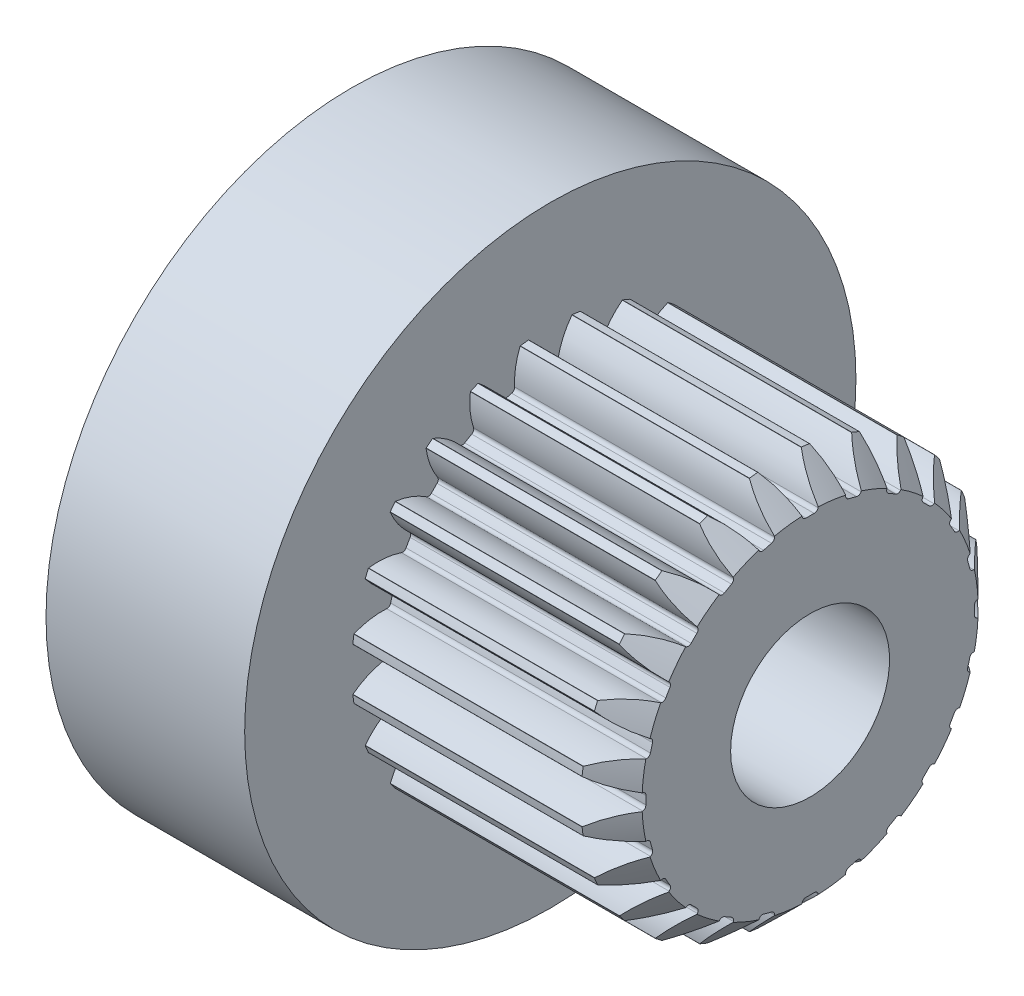
from build123d import *

# Parameters (mm, degrees)
BASPROSKE_W                = 8.5
BASPROSKE_H                = 6.500000000000001
TOOTHCUT_DEPTH             = 13.519984025548915
BREAKS_R                   = 0.01
ROOTFILLETS_R              = 0.126
TEETHCUTS_COUNT            = 24
TEETHCUTS_ANGLE            = 345.0000000000008
BREAKS_OF_TEETHCUTS_R      = 0.01
ROOTFILLETS_OF_TEETHCUTS_R = 0.126
HUBNEAONESKE_R             = 5
HUBNEARONE_DEPTH           = 6.5000508
BORSKE_R                   = 2.6000000000000005
BORE_DEPTH                 = 20.0000508
BOSS_EXTRUDE1_START        = -6.5000508
SKETCH1_R                  = 10
SKETCH1_R_2                = 2.6000000000000005
BOSS_EXTRUDE1_DEPTH        = 6.5000508
SKETCH7_R                  = 1.8
CUT_EXTRUDE7_DEPTH         = 17.50000017272729
SKETCH8_W                  = 5.5
SKETCH8_H                  = 2.1000000000000005
CUT_EXTRUDE8_DEPTH         = 2.5
SKETCH9_W                  = 5.5
SKETCH9_H                  = 2.1000000000000005
CUT_EXTRUDE9_DEPTH         = 21.076434712227034


with BuildPart() as part:
    # BasProSke → Base-Revolve (revolve)
    with BuildSketch(Plane(origin=(0, 0, 0), x_dir=(1, 0, 0), z_dir=(0, 1, 0)), mode=Mode.PRIVATE) as base_revolve_sk:
        with Locations((4.25, 3.2500000000000004)):
            Rectangle(BASPROSKE_W, BASPROSKE_H)
    revolve(base_revolve_sk.sketch.rotate(Axis((-10, 0, 0), (1, 0, 0)), 180), axis=Axis((-10, 0, 0), (1, 0, 0)))

    # TooCutSke → ToothCut (cut, through all)
    with BuildSketch(Plane(origin=(0, 0, 0), x_dir=(0, 0, -1), z_dir=(1, 0, 0))):
        with BuildLine():
            ThreePointArc((0.2416461081958957, 5.368564347979241), (3.3e-16, 5.374), (-0.2416461081958957, 5.368564347979241))
            ThreePointArc((-0.2416461081958957, 5.368564347979241), (-0.4136999570458344, 5.957993365165113), (-0.7296860368052384, 6.484474030150129))
            ThreePointArc((-0.7296860368052384, 6.484474030150129), (4e-16, 6.525399999999999), (0.7296860368052384, 6.484474030150129))
            ThreePointArc((0.7296860368052384, 6.484474030150129), (0.41369995704583573, 5.9579933651651125), (0.2416461081958957, 5.368564347979241))
        make_face()
    toothcut = extrude(amount=TOOTHCUT_DEPTH, mode=Mode.SUBTRACT)

    # Breaks
    # the kernel refuses this fillet: 0.01 mm, written as the material it takes off along each edge
    with BuildSketch(Plane(origin=(-0.0141063886709076, 6.460959589415369, -0.7113376019455104), x_dir=(0, -0.7929099100276569, 0.6093388832004184), z_dir=(1, 0, 0))) as breaks_piece_1:
        with BuildLine():
            CenterArc((0.00563080014443655, 0.00999999309061561), BREAKS_R, 211.20920670905093, 58.85814635104691)
            ThreePointArc((-0.00292200994268142, 0.00481834860129642), (-0.00146152712507896, 0.00240885764892245), (0, 0))
            ThreePointArc((0, 0), (0.00282127773416398, -1.65825225064e-06), (0.00564255546832916, 0))
        make_face()
    extrude(amount=8.528212777341647, mode=Mode.SUBTRACT)
    with BuildSketch(Plane(origin=(-0.01410638867090685, 6.460959589415369, 0.7113376019455102), x_dir=(0, -0.7929099100276678, -0.6093388832004042), z_dir=(1, 0, 0))) as breaks_piece_2:
        with BuildLine():
            CenterArc((0.00563080014443777, -0.00999999309061561), BREAKS_R, 89.93264693990317, 58.858146351028566)
            ThreePointArc((-0.00292200994267833, -0.00481834860129402), (-0.00146152712507387, -0.00240885764891446), (0, 0))
            ThreePointArc((0, 0), (0.00282127773416523, 1.65825225086e-06), (0.0056425554683302, 0))
        make_face()
    extrude(amount=8.528212777341647, mode=Mode.SUBTRACT)

    # RootFillets
    rootfillets_edges = [part.edges().sort_by_distance(p)[0] for p in [
        (4.25, 5.368564347979241, -0.24164610819589544),
        (4.25, 5.368564347979241, 0.24164610819589563),
    ]]
    fillet(rootfillets_edges, radius=ROOTFILLETS_R)

    # TeethCuts: ToothCut ×24 about axis
    teethcuts_axis = Axis((-10, 0, 0), (1, 0, 0))
    for i in range(1, TEETHCUTS_COUNT):
        add(toothcut.rotate(teethcuts_axis, i * TEETHCUTS_ANGLE / (TEETHCUTS_COUNT - 1)), mode=Mode.SUBTRACT)

    # Breaks of TeethCuts
    # the kernel refuses this fillet: 0.01 mm, written as the material it takes off along each edge
    with BuildSketch(Plane(origin=(-0.01410638867090785, 6.424915448907373, 0.985120030448763), x_dir=(0, 0.15112844965438915, -0.988514133285438), z_dir=(1, 0, 0))) as breaks_of_teethcuts_piece_1:
        with BuildLine():
            CenterArc((0.00563078954221437, -0.00999999906051367), BREAKS_OF_TEETHCUTS_R, 89.97516393486379, 58.85814635104916)
            ThreePointArc((-0.0029258632888678, -0.0048247027087736), (-0.00146434954350002, -0.00241149149232399), (0, 0))
            ThreePointArc((0, 0), (0.00281756212659148, 6.1066590053e-07), (0.00563512425317729, 0))
        make_face()
    extrude(amount=8.528212777341647, mode=Mode.SUBTRACT)
    with BuildSketch(Plane(origin=(-0.01410638867091247, 6.056700011145264, 2.359318752308165), x_dir=(0, -0.6081836521223912, -0.7937963500111791), z_dir=(1, 0, 0))) as breaks_of_teethcuts_piece_2:
        with BuildLine():
            CenterArc((0.00563080014443676, -0.00999999309061569), BREAKS_OF_TEETHCUTS_R, 89.9326469398973, 58.858146351029404)
            ThreePointArc((-0.002922009942679, -0.00481834860129328), (-0.00146152712507712, -0.00240885764891895), (0, 0))
            ThreePointArc((0, 0), (0.00282127773416467, 1.65825225092e-06), (0.00564255546833021, 0))
        make_face()
    extrude(amount=8.528212777341658, mode=Mode.SUBTRACT)
    with BuildSketch(Plane(origin=(-0.01410638867090776, 5.951023938231137, 2.614443360755777), x_dir=(0, 0.4018251566555056, -0.9157164099647763), z_dir=(1, 0, 0))) as breaks_of_teethcuts_piece_3:
        with BuildLine():
            CenterArc((0.00563078954221485, -0.00999999906051393), BREAKS_OF_TEETHCUTS_R, 89.97516393486309, 58.85814635104218)
            ThreePointArc((-0.00292586328886661, -0.00482470270877273), (-0.00146434954349871, -0.00241149149232289), (0, 0))
            ThreePointArc((0, 0), (0.00281756212659176, 6.1066590085e-07), (0.00563512425317789, 0))
        make_face()
    extrude(amount=8.528212777341647, mode=Mode.SUBTRACT)
    with BuildSketch(Plane(origin=(-0.01410638867090984, 5.239686336285626, 3.846516228659606), x_dir=(0, -0.38201068339611227, -0.9241579073790557), z_dir=(1, 0, 0))) as breaks_of_teethcuts_piece_4:
        with BuildLine():
            CenterArc((0.00563080014443654, -0.00999999309061607), BREAKS_OF_TEETHCUTS_R, 89.93264693989873, 58.858146351022455)
            ThreePointArc((-0.00292200994267875, -0.00481834860129282), (-0.00146152712507713, -0.00240885764891821), (0, 0))
            ThreePointArc((0, 0), (0.00282127773416588, 1.65825225051e-06), (0.00564255546832975, 0))
        make_face()
    extrude(amount=8.52821277734165, mode=Mode.SUBTRACT)
    with BuildSketch(Plane(origin=(-0.01410638867091184, 5.0715799806965, 4.06559669659922), x_dir=(0, 0.6251381432780814, -0.7805141265978681), z_dir=(1, 0, 0))) as breaks_of_teethcuts_piece_5:
        with BuildLine():
            CenterArc((0.00563078954220711, -0.00999999906051358), BREAKS_OF_TEETHCUTS_R, 89.97516393485647, 58.8581463510305)
            ThreePointArc((-0.00292586328887291, -0.00482470270876951), (-0.0014643495435013, -0.00241149149232257), (0, 0))
            ThreePointArc((0, 0), (0.00281756212658576, 6.1066590059e-07), (0.00563512425317131, 0))
        make_face()
    extrude(amount=8.528212777341656, mode=Mode.SUBTRACT)
    with BuildSketch(Plane(origin=(-0.01410638867090418, 4.0655966965992025, 5.071579980696514), x_dir=(0, -0.1298043178990405, -0.9915396306022088), z_dir=(1, 0, 0))) as breaks_of_teethcuts_piece_6:
        with BuildLine():
            CenterArc((0.00563080014443722, -0.00999999309061523), BREAKS_OF_TEETHCUTS_R, 89.93264693990731, 58.85814635105554)
            ThreePointArc((-0.00292200994268193, -0.00481834860129815), (-0.00146152712507574, -0.0024088576489189), (0, 0))
            ThreePointArc((0, 0), (0.00282127773416439, 1.65825225115e-06), (0.00564255546832893, 0))
        make_face()
    extrude(amount=8.52821277734164, mode=Mode.SUBTRACT)
    with BuildSketch(Plane(origin=(-0.01410638867090556, 3.8465162286595866, 5.239686336285639), x_dir=(0, 0.8058489985258117, -0.5921210953639013), z_dir=(1, 0, 0))) as breaks_of_teethcuts_piece_7:
        with BuildLine():
            CenterArc((0.00563078954221272, -0.0099999990605139), BREAKS_OF_TEETHCUTS_R, 89.97516393485175, 58.85814635104741)
            ThreePointArc((-0.00292586328886815, -0.0048247027087718), (-0.00146434954350067, -0.00241149149232245), (0, 0))
            ThreePointArc((0, 0), (0.00281756212659191, 6.1066590041e-07), (0.00563512425317774, 0))
        make_face()
    extrude(amount=8.528212777341643, mode=Mode.SUBTRACT)
    with BuildSketch(Plane(origin=(-0.01410638867090834, 2.6144433607557565, 5.951023938231146), x_dir=(0, 0.13124799735132045, -0.9913495665966007), z_dir=(1, 0, 0))) as breaks_of_teethcuts_piece_8:
        with BuildLine():
            CenterArc((0.00563080014443814, -0.00999999309061575), BREAKS_OF_TEETHCUTS_R, 89.93264693990707, 58.85814635102807)
            ThreePointArc((-0.00292200994267834, -0.00481834860129463), (-0.00146152712507528, -0.00240885764891462), (0, 0))
            ThreePointArc((0, 0), (0.00282127773416509, 1.65825225065e-06), (0.00564255546832989, 0))
        make_face()
    extrude(amount=8.52821277734165, mode=Mode.SUBTRACT)
    with BuildSketch(Plane(origin=(-0.01410638867090896, 2.359318752308144, 6.056700011145273), x_dir=(0, 0.9316425762523523, -0.3633759900074302), z_dir=(1, 0, 0))) as breaks_of_teethcuts_piece_9:
        with BuildLine():
            CenterArc((0.00563078954221484, -0.0099999990605142), BREAKS_OF_TEETHCUTS_R, 89.97516393486302, 58.8581463510416)
            ThreePointArc((-0.00292586328886624, -0.0048247027087731), (-0.00146434954349887, -0.00241149149232392), (0, 0))
            ThreePointArc((0, 0), (0.002817562126592, 6.1066590075e-07), (0.0056351242531779, 0))
        make_face()
    extrude(amount=8.52821277734165, mode=Mode.SUBTRACT)
    with BuildSketch(Plane(origin=(-0.01410638867090717, 0.98512003044874, 6.4249154489073765), x_dir=(0, 0.3833559784797053, -0.9236006679100376), z_dir=(1, 0, 0))) as breaks_of_teethcuts_piece_10:
        with BuildLine():
            CenterArc((0.00563080014443772, -0.00999999309061561), BREAKS_OF_TEETHCUTS_R, 89.93264693990577, 58.85814635102298)
            ThreePointArc((-0.00292200994267852, -0.00481834860129333), (-0.00146152712507609, -0.00240885764891914), (0, 0))
            ThreePointArc((0, 0), (0.00282127773416493, 1.65825225089e-06), (0.0056425554683297, 0))
        make_face()
    extrude(amount=8.528212777341647, mode=Mode.SUBTRACT)
    with BuildSketch(Plane(origin=(-0.01410638867091392, 0.7113376019454875, 6.4609595894153715), x_dir=(0, 0.9939462520195419, -0.10986741143899431), z_dir=(1, 0, 0))) as breaks_of_teethcuts_piece_11:
        with BuildLine():
            CenterArc((0.00563078954221374, -0.00999999906051379), BREAKS_OF_TEETHCUTS_R, 89.97516393485907, 58.85814635105166)
            ThreePointArc((-0.0029258632888681, -0.00482470270877347), (-0.00146434954349995, -0.00241149149232406), (0, 0))
            ThreePointArc((0, 0), (0.0028175621265916, 6.1066590077e-07), (0.00563512425317749, 0))
        make_face()
    extrude(amount=8.52821277734166, mode=Mode.SUBTRACT)
    with BuildSketch(Plane(origin=(-0.01410638867090963, -0.7113376019455324, 6.460959589415366), x_dir=(0, 0.6093388832004555, -0.7929099100276283), z_dir=(1, 0, 0))) as breaks_of_teethcuts_piece_12:
        with BuildLine():
            CenterArc((0.00563080014443629, -0.00999999309061561), BREAKS_OF_TEETHCUTS_R, 89.93264693989946, 58.85814635103873)
            ThreePointArc((-0.00292200994268056, -0.00481834860129488), (-0.00146152712507761, -0.00240885764891903), (0, 0))
            ThreePointArc((0, 0), (0.00282127773416398, 1.65825225051e-06), (0.00564255546832937, 0))
        make_face()
    extrude(amount=8.52821277734165, mode=Mode.SUBTRACT)
    with BuildSketch(Plane(origin=(-0.01410638867090513, -0.9851200304487869, 6.4249154489073685), x_dir=(0, 0.9885141332854086, 0.15112844965458144), z_dir=(1, 0, 0))) as breaks_of_teethcuts_piece_13:
        with BuildLine():
            CenterArc((0.00563078954221125, -0.00999999906051369), BREAKS_OF_TEETHCUTS_R, 89.97516393485327, 58.85814635103742)
            ThreePointArc((-0.00292586328886888, -0.00482470270877032), (-0.00146434954350014, -0.00241149149232286), (0, 0))
            ThreePointArc((0, 0), (0.00281756212658786, 6.1066590054e-07), (0.005635124253176, 0))
        make_face()
    extrude(amount=8.528212777341643, mode=Mode.SUBTRACT)
    with BuildSketch(Plane(origin=(-0.01410638867090801, -2.359318752308188, 6.056700011145255), x_dir=(0, 0.79379635001115, -0.6081836521224292), z_dir=(1, 0, 0))) as breaks_of_teethcuts_piece_14:
        with BuildLine():
            CenterArc((0.00563080014443688, -0.00999999309061569), BREAKS_OF_TEETHCUTS_R, 89.93264693990004, 58.85814635103888)
            ThreePointArc((-0.00292200994268053, -0.00481834860129477), (-0.00146152712507736, -0.00240885764891929), (0, 0))
            ThreePointArc((0, 0), (0.00282127773416467, 1.65825225106e-06), (0.00564255546832986, 0))
        make_face()
    extrude(amount=8.528212777341647, mode=Mode.SUBTRACT)
    with BuildSketch(Plane(origin=(-0.0141063886709082, -2.6144433607557973, 5.9510239382311285), x_dir=(0, 0.9157164099647128, 0.40182515665565066), z_dir=(1, 0, 0))) as breaks_of_teethcuts_piece_15:
        with BuildLine():
            CenterArc((0.00563078954221124, -0.00999999906051393), BREAKS_OF_TEETHCUTS_R, 89.97516393485402, 58.85814635103712)
            ThreePointArc((-0.00292586328886905, -0.00482470270877056), (-0.00146434954350027, -0.00241149149232312), (0, 0))
            ThreePointArc((0, 0), (0.00281756212658815, 6.1066590101e-07), (0.00563512425317586, 0))
        make_face()
    extrude(amount=8.528212777341649, mode=Mode.SUBTRACT)
    with BuildSketch(Plane(origin=(-0.01410638867090984, -3.846516228659624, 5.239686336285613), x_dir=(0, 0.9241579073790002, -0.3820106833962467), z_dir=(1, 0, 0))) as breaks_of_teethcuts_piece_16:
        with BuildLine():
            CenterArc((0.00563080014443875, -0.0099999930906159), BREAKS_OF_TEETHCUTS_R, 89.93264693990943, 58.85814635104043)
            ThreePointArc((-0.00292200994267949, -0.00481834860129672), (-0.00146152712507685, -0.00240885764891941), (0, 0))
            ThreePointArc((0, 0), (0.00282127773416506, 1.65825225059e-06), (0.00564255546833009, 0))
        make_face()
    extrude(amount=8.52821277734165, mode=Mode.SUBTRACT)
    with BuildSketch(Plane(origin=(-0.01410638867090801, -4.065596696599239, 5.071579980696485), x_dir=(0, 0.7805141265978223, 0.6251381432781387), z_dir=(1, 0, 0))) as breaks_of_teethcuts_piece_17:
        with BuildLine():
            CenterArc((0.00563078954221012, -0.00999999906051358), BREAKS_OF_TEETHCUTS_R, 89.97516393485225, 58.858146351041256)
            ThreePointArc((-0.00292586328886994, -0.00482470270877083), (-0.00146434954349884, -0.00241149149232344), (0, 0))
            ThreePointArc((0, 0), (0.00281756212658826, 6.1066590066e-07), (0.00563512425317505, 0))
        make_face()
    extrude(amount=8.528212777341647, mode=Mode.SUBTRACT)
    with BuildSketch(Plane(origin=(-0.01410638867090447, -5.071579980696527, 4.065596696599185), x_dir=(0, 0.9915396306022266, -0.12980431789890604), z_dir=(1, 0, 0))) as breaks_of_teethcuts_piece_18:
        with BuildLine():
            CenterArc((0.00563080014443587, -0.009999993090616), BREAKS_OF_TEETHCUTS_R, 89.93264693990525, 58.85814635103554)
            ThreePointArc((-0.00292200994268105, -0.00481834860129576), (-0.00146152712507783, -0.00240885764891893), (0, 0))
            ThreePointArc((0, 0), (0.00282127773416439, 1.65825225077e-06), (0.00564255546832793, 0))
        make_face()
    extrude(amount=8.52821277734164, mode=Mode.SUBTRACT)
    with BuildSketch(Plane(origin=(-0.01410638867090387, -5.2396863362856525, 3.846516228659568), x_dir=(0, 0.5921210953639495, 0.8058489985257764), z_dir=(1, 0, 0))) as breaks_of_teethcuts_piece_19:
        with BuildLine():
            CenterArc((0.00563078954221136, -0.0099999990605139), BREAKS_OF_TEETHCUTS_R, 89.97516393485516, 58.85814635104272)
            ThreePointArc((-0.0029258632888691, -0.00482470270877179), (-0.0014643495435, -0.00241149149232325), (0, 0))
            ThreePointArc((0, 0), (0.00281756212658783, 6.1066590088e-07), (0.00563512425317579, 0))
        make_face()
    extrude(amount=8.52821277734164, mode=Mode.SUBTRACT)
    with BuildSketch(Plane(origin=(-0.01410638867091054, -5.951023938231156, 2.614443360755735), x_dir=(0, 0.9913495665965877, 0.1312479973514183), z_dir=(1, 0, 0))) as breaks_of_teethcuts_piece_20:
        with BuildLine():
            CenterArc((0.00563080014443633, -0.00999999309061575), BREAKS_OF_TEETHCUTS_R, 89.9326469399014, 58.85814635104383)
            ThreePointArc((-0.00292200994268169, -0.00481834860129576), (-0.00146152712507809, -0.0024088576489204), (0, 0))
            ThreePointArc((0, 0), (0.00282127773416426, 1.65825225093e-06), (0.00564255546832906, 0))
        make_face()
    extrude(amount=8.528212777341654, mode=Mode.SUBTRACT)
    with BuildSketch(Plane(origin=(-0.01410638867090626, -6.0567000111452804, 2.3593187523081243), x_dir=(0, 0.3633759900073434, 0.9316425762523862), z_dir=(1, 0, 0))) as breaks_of_teethcuts_piece_21:
        with BuildLine():
            CenterArc((0.00563078954221037, -0.0099999990605142), BREAKS_OF_TEETHCUTS_R, 89.97516393485766, 58.85814635104161)
            ThreePointArc((-0.00292586328887023, -0.0048247027087723), (-0.00146434954350108, -0.0024114914923236), (0, 0))
            ThreePointArc((0, 0), (0.00281756212658689, 6.1066590136e-07), (0.00563512425317436, 0))
        make_face()
    extrude(amount=8.528212777341643, mode=Mode.SUBTRACT)
    with BuildSketch(Plane(origin=(-0.01410638867090502, -6.42491544890738, 0.9851200304487173), x_dir=(0, 0.9236006679100376, 0.3833559784797053), z_dir=(1, 0, 0))) as breaks_of_teethcuts_piece_22:
        with BuildLine():
            CenterArc((0.00563080014443772, -0.00999999309061561), BREAKS_OF_TEETHCUTS_R, 89.93264693990577, 58.858146351039295)
            ThreePointArc((-0.00292200994267963, -0.00481834860129599), (-0.00146152712507742, -0.00240885764892003), (0, 0))
            ThreePointArc((0, 0), (0.00282127773416493, 1.65825225089e-06), (0.0056425554683297, 0))
        make_face()
    extrude(amount=8.528212777341643, mode=Mode.SUBTRACT)
    with BuildSketch(Plane(origin=(-0.01410638867090844, -6.460959589415374, 0.7113376019454647), x_dir=(0, 0.10986741143902229, 0.9939462520195388), z_dir=(1, 0, 0))) as breaks_of_teethcuts_piece_23:
        with BuildLine():
            CenterArc((0.00563078954221259, -0.00999999906051379), BREAKS_OF_TEETHCUTS_R, 89.97516393486067, 58.858146351040105)
            ThreePointArc((-0.0029258632888686, -0.00482470270877184), (-0.00146434954349943, -0.00241149149232316), (0, 0))
            ThreePointArc((0, 0), (0.00281756212658885, 6.1066590055e-07), (0.00563512425317605, 0))
        make_face()
    extrude(amount=8.52821277734165, mode=Mode.SUBTRACT)
    with BuildSketch(Plane(origin=(-0.01410638867090391, -6.4609595894153635, -0.7113376019455555), x_dir=(0, 0.7929099100276094, 0.6093388832004802), z_dir=(1, 0, 0))) as breaks_of_teethcuts_piece_24:
        with BuildLine():
            CenterArc((0.00563080014443611, -0.00999999309061561), BREAKS_OF_TEETHCUTS_R, 89.93264693989767, 58.85814635104441)
            ThreePointArc((-0.00292200994268119, -0.0048183486012954), (-0.00146152712507761, -0.00240885764891889), (0, 0))
            ThreePointArc((0, 0), (0.00282127773416399, 1.65825225042e-06), (0.0056425554683295, 0))
        make_face()
    extrude(amount=8.52821277734164, mode=Mode.SUBTRACT)
    with BuildSketch(Plane(origin=(-0.01410638867091069, -6.424915448907366, -0.985120030448808), x_dir=(0, -0.15112844965442154, 0.9885141332854331), z_dir=(1, 0, 0))) as breaks_of_teethcuts_piece_25:
        with BuildLine():
            CenterArc((0.00563078954221295, -0.00999999906051369), BREAKS_OF_TEETHCUTS_R, 89.97516393486254, 58.858146351043075)
            ThreePointArc((-0.00292586328886859, -0.00482470270877251), (-0.00146434954349953, -0.00241149149232314), (0, 0))
            ThreePointArc((0, 0), (0.00281756212658873, 6.1066590086e-07), (0.00563512425317609, 0))
        make_face()
    extrude(amount=8.528212777341654, mode=Mode.SUBTRACT)
    with BuildSketch(Plane(origin=(-0.01410638867091289, -6.056700011145247, -2.359318752308206), x_dir=(0, 0.6081836521224292, 0.79379635001115), z_dir=(1, 0, 0))) as breaks_of_teethcuts_piece_26:
        with BuildLine():
            CenterArc((0.00563080014443688, -0.00999999309061569), BREAKS_OF_TEETHCUTS_R, 89.93264693990004, 58.85814635103414)
            ThreePointArc((-0.00292200994267983, -0.00481834860129423), (-0.0014615271250779, -0.00240885764891858), (0, 0))
            ThreePointArc((0, 0), (0.00282127773416521, 1.65825225035e-06), (0.00564255546832986, 0))
        make_face()
    extrude(amount=8.528212777341658, mode=Mode.SUBTRACT)
    with BuildSketch(Plane(origin=(-0.01410638867090834, -5.951023938231118, -2.614443360755821), x_dir=(0, -0.40182515665551843, 0.9157164099647708), z_dir=(1, 0, 0))) as breaks_of_teethcuts_piece_27:
        with BuildLine():
            CenterArc((0.00563078954221232, -0.00999999906051393), BREAKS_OF_TEETHCUTS_R, 89.9751639348623, 58.85814635103712)
            ThreePointArc((-0.00292586328886871, -0.00482470270877179), (-0.00146434954349992, -0.00241149149232333), (0, 0))
            ThreePointArc((0, 0), (0.00281756212658698, 6.1066590097e-07), (0.0056351242531755, 0))
        make_face()
    extrude(amount=8.52821277734165, mode=Mode.SUBTRACT)
    with BuildSketch(Plane(origin=(-0.0141063886709126, -5.239686336285597, -3.8465162286596435), x_dir=(0, 0.38201068339616784, 0.9241579073790327), z_dir=(1, 0, 0))) as breaks_of_teethcuts_piece_28:
        with BuildLine():
            CenterArc((0.00563080014443673, -0.0099999930906159), BREAKS_OF_TEETHCUTS_R, 89.93264693990454, 58.858146351033355)
            ThreePointArc((-0.00292200994268058, -0.00481834860129483), (-0.00146152712507739, -0.00240885764891846), (0, 0))
            ThreePointArc((0, 0), (0.00282127773416424, 1.65825225001e-06), (0.00564255546832893, 0))
        make_face()
    extrude(amount=8.528212777341658, mode=Mode.SUBTRACT)
    with BuildSketch(Plane(origin=(-0.01410638867092007, -5.07157998069647, -4.065596696599258), x_dir=(0, -0.6251381432781387, 0.7805141265978223), z_dir=(1, 0, 0))) as breaks_of_teethcuts_piece_29:
        with BuildLine():
            CenterArc((0.00563078954221012, -0.00999999906051358), BREAKS_OF_TEETHCUTS_R, 89.97516393485225, 58.858146351041256)
            ThreePointArc((-0.00292586328886994, -0.00482470270877083), (-0.0014643495434994, -0.00241149149232413), (0, 0))
            ThreePointArc((0, 0), (0.00281756212658576, 6.1066590038e-07), (0.00563512425317505, 0))
        make_face()
    extrude(amount=8.528212777341672, mode=Mode.SUBTRACT)
    with BuildSketch(Plane(origin=(-0.0141063886709083, -4.065596696599167, -5.071579980696542), x_dir=(0, 0.12980431789886548, 0.9915396306022317), z_dir=(1, 0, 0))) as breaks_of_teethcuts_piece_30:
        with BuildLine():
            CenterArc((0.00563080014443722, -0.009999993090616), BREAKS_OF_TEETHCUTS_R, 89.93264693990291, 58.85814635103155)
            ThreePointArc((-0.0029220099426796, -0.00481834860129453), (-0.00146152712507781, -0.00240885764891975), (0, 0))
            ThreePointArc((0, 0), (0.00282127773416451, 1.65825224977e-06), (0.00564255546832969, 0))
        make_face()
    extrude(amount=8.528212777341649, mode=Mode.SUBTRACT)
    with BuildSketch(Plane(origin=(-0.01410638867090609, -3.8465162286595516, -5.239686336285666), x_dir=(0, -0.8058489985256658, 0.5921210953640998), z_dir=(1, 0, 0))) as breaks_of_teethcuts_piece_31:
        with BuildLine():
            CenterArc((0.00563078954221215, -0.00999999906051364), BREAKS_OF_TEETHCUTS_R, 89.97516393486791, 58.85814635103637)
            ThreePointArc((-0.00292586328886944, -0.00482470270877215), (-0.00146434954350007, -0.00241149149232281), (0, 0))
            ThreePointArc((0, 0), (0.00281756212658871, 6.1066590096e-07), (0.00563512425317435, 0))
        make_face()
    extrude(amount=8.528212777341643, mode=Mode.SUBTRACT)
    with BuildSketch(Plane(origin=(-0.01410638867091055, -2.6144433607557147, -5.951023938231166), x_dir=(0, -0.13124799735135684, 0.9913495665965958), z_dir=(1, 0, 0))) as breaks_of_teethcuts_piece_32:
        with BuildLine():
            CenterArc((0.00563080014443959, -0.00999999309061575), BREAKS_OF_TEETHCUTS_R, 89.93264693990496, 58.85814635103945)
            ThreePointArc((-0.00292200994267781, -0.00481834860129596), (-0.00146152712507589, -0.00240885764891852), (0, 0))
            ThreePointArc((0, 0), (0.00282127773416514, 1.65825225098e-06), (0.00564255546833171, 0))
        make_face()
    extrude(amount=8.528212777341654, mode=Mode.SUBTRACT)
    with BuildSketch(Plane(origin=(-0.01410638867091418, -2.359318752308103, -6.056700011145288), x_dir=(0, -0.9316425762523964, 0.36337599000731663), z_dir=(1, 0, 0))) as breaks_of_teethcuts_piece_33:
        with BuildLine():
            CenterArc((0.0056307895422105, -0.0099999990605142), BREAKS_OF_TEETHCUTS_R, 89.97516393485603, 58.858146351043644)
            ThreePointArc((-0.00292586328887037, -0.00482470270877221), (-0.00146434954350147, -0.00241149149232273), (0, 0))
            ThreePointArc((0, 0), (0.00281756212658846, 6.1066590093e-07), (0.00563512425317477, 0))
        make_face()
    extrude(amount=8.528212777341661, mode=Mode.SUBTRACT)
    with BuildSketch(Plane(origin=(-0.01410638867090598, -0.9851200304486956, -6.424915448907384), x_dir=(0, -0.38335597847977243, 0.9236006679100097), z_dir=(1, 0, 0))) as breaks_of_teethcuts_piece_34:
        with BuildLine():
            CenterArc((0.00563080014443717, -0.00999999309061561), BREAKS_OF_TEETHCUTS_R, 89.93264693990162, 58.85814635103742)
            ThreePointArc((-0.00292200994267968, -0.00481834860129506), (-0.00146152712507794, -0.00240885764892074), (0, 0))
            ThreePointArc((0, 0), (0.00282127773416592, 1.65825225075e-06), (0.00564255546832987, 0))
        make_face()
    extrude(amount=8.528212777341643, mode=Mode.SUBTRACT)
    with BuildSketch(Plane(origin=(-0.01410638867091037, -0.7113376019454436, -6.460959589415376), x_dir=(0, -0.9939462520195529, 0.10986741143889454), z_dir=(1, 0, 0))) as breaks_of_teethcuts_piece_35:
        with BuildLine():
            CenterArc((0.00563078954220977, -0.00999999906051379), BREAKS_OF_TEETHCUTS_R, 89.97516393485333, 58.85814635104492)
            ThreePointArc((-0.00292586328887087, -0.00482470270877164), (-0.00146434954350106, -0.00241149149232312), (0, 0))
            ThreePointArc((0, 0), (0.00281756212658885, 6.1066590018e-07), (0.00563512425317452, 0))
        make_face()
    extrude(amount=8.528212777341654, mode=Mode.SUBTRACT)
    with BuildSketch(Plane(origin=(-0.01410638867090743, 0.7113376019455773, -6.460959589415362), x_dir=(0, -0.6093388832003317, 0.7929099100277234), z_dir=(1, 0, 0))) as breaks_of_teethcuts_piece_36:
        with BuildLine():
            CenterArc((0.00563080014443717, -0.00999999309061561), BREAKS_OF_TEETHCUTS_R, 89.93264693990841, 58.85814635103364)
            ThreePointArc((-0.00292200994267995, -0.00481834860129551), (-0.00146152712507605, -0.00240885764891918), (0, 0))
            ThreePointArc((0, 0), (0.00282127773416287, 1.65825225096e-06), (0.00564255546832869, 0))
        make_face()
    extrude(amount=8.528212777341647, mode=Mode.SUBTRACT)
    with BuildSketch(Plane(origin=(-0.01410638867090481, 0.985120030448829, -6.424915448907362), x_dir=(0, -0.9885141332854268, -0.15112844965446273), z_dir=(1, 0, 0))) as breaks_of_teethcuts_piece_37:
        with BuildLine():
            CenterArc((0.005630789542211, -0.00999999906051369), BREAKS_OF_TEETHCUTS_R, 89.97516393486015, 58.85814635103199)
            ThreePointArc((-0.00292586328886929, -0.00482470270877052), (-0.00146434954350062, -0.00241149149232292), (0, 0))
            ThreePointArc((0, 0), (0.00281756212658876, 6.1066590164e-07), (0.00563512425317455, 0))
        make_face()
    extrude(amount=8.528212777341643, mode=Mode.SUBTRACT)
    with BuildSketch(Plane(origin=(-0.01410638867091377, 2.359318752308228, -6.056700011145239), x_dir=(0, -0.7937963500111321, 0.6081836521224524), z_dir=(1, 0, 0))) as breaks_of_teethcuts_piece_38:
        with BuildLine():
            CenterArc((0.00563080014443842, -0.00999999309061569), BREAKS_OF_TEETHCUTS_R, 89.93264693990172, 58.85814635104309)
            ThreePointArc((-0.00292200994267896, -0.004818348601296), (-0.00146152712507677, -0.00240885764891782), (0, 0))
            ThreePointArc((0, 0), (0.00282127773416432, 1.65825225087e-06), (0.00564255546833111, 0))
        make_face()
    extrude(amount=8.52821277734166, mode=Mode.SUBTRACT)
    with BuildSketch(Plane(origin=(-0.01410638867090584, 2.6144433607558377, -5.951023938231111), x_dir=(0, -0.9157164099648032, -0.40182515665544427), z_dir=(1, 0, 0))) as breaks_of_teethcuts_piece_39:
        with BuildLine():
            CenterArc((0.00563078954221196, -0.00999999906051393), BREAKS_OF_TEETHCUTS_R, 89.97516393486694, 58.858146351042166)
            ThreePointArc((-0.00292586328886984, -0.0048247027087733), (-0.0014643495435013, -0.00241149149232372), (0, 0))
            ThreePointArc((0, 0), (0.0028175621265882, 6.1066590066e-07), (0.00563512425317433, 0))
        make_face()
    extrude(amount=8.528212777341643, mode=Mode.SUBTRACT)
    with BuildSketch(Plane(origin=(-0.01410638867090796, 3.8465162286596604, -5.239686336285587), x_dir=(0, -0.9241579073790002, 0.3820106833962467), z_dir=(1, 0, 0))) as breaks_of_teethcuts_piece_40:
        with BuildLine():
            CenterArc((0.00563080014443875, -0.0099999930906159), BREAKS_OF_TEETHCUTS_R, 89.93264693990943, 58.858146351033355)
            ThreePointArc((-0.00292200994267901, -0.00481834860129556), (-0.00146152712507596, -0.00240885764891808), (0, 0))
            ThreePointArc((0, 0), (0.00282127773416465, 1.65825225042e-06), (0.00564255546833009, 0))
        make_face()
    extrude(amount=8.528212777341647, mode=Mode.SUBTRACT)
    with BuildSketch(Plane(origin=(-0.0141063886709086, 4.065596696599273, -5.071579980696458), x_dir=(0, -0.7805141265978991, -0.6251381432780426), z_dir=(1, 0, 0))) as breaks_of_teethcuts_piece_41:
        with BuildLine():
            CenterArc((0.00563078954221079, -0.00999999906051358), BREAKS_OF_TEETHCUTS_R, 89.9751639348593, 58.85814635104629)
            ThreePointArc((-0.00292586328887045, -0.00482470270877257), (-0.00146434954350049, -0.0024114914923232), (0, 0))
            ThreePointArc((0, 0), (0.00281756212658895, 6.1066590045e-07), (0.0056351242531745, 0))
        make_face()
    extrude(amount=8.52821277734165, mode=Mode.SUBTRACT)
    with BuildSketch(Plane(origin=(-0.01410638867091079, 5.071579980696556, -4.06559669659915), x_dir=(0, -0.9915396306022318, 0.1298043178988655), z_dir=(1, 0, 0))) as breaks_of_teethcuts_piece_42:
        with BuildLine():
            CenterArc((0.00563080014443722, -0.009999993090616), BREAKS_OF_TEETHCUTS_R, 89.93264693990291, 58.85814635103556)
            ThreePointArc((-0.00292200994267949, -0.00481834860129541), (-0.00146152712507769, -0.00240885764892063), (0, 0))
            ThreePointArc((0, 0), (0.00282127773416439, 1.65825225065e-06), (0.00564255546832969, 0))
        make_face()
    extrude(amount=8.528212777341654, mode=Mode.SUBTRACT)
    with BuildSketch(Plane(origin=(-0.01410638867090676, 5.239686336285681, -3.8465162286595302), x_dir=(0, -0.5921210953640038, -0.8058489985257365), z_dir=(1, 0, 0))) as breaks_of_teethcuts_piece_43:
        with BuildLine():
            CenterArc((0.00563078954221487, -0.00999999906051364), BREAKS_OF_TEETHCUTS_R, 89.97516393486107, 58.858146351040645)
            ThreePointArc((-0.00292586328886594, -0.0048247027087721), (-0.00146434954349752, -0.00241149149232275), (0, 0))
            ThreePointArc((0, 0), (0.00281756212659191, 6.1066590077e-07), (0.00563512425317827, 0))
        make_face()
    extrude(amount=8.528212777341647, mode=Mode.SUBTRACT)
    with BuildSketch(Plane(origin=(-0.01410638867091069, 5.951023938231174, -2.614443360755694), x_dir=(0, -0.9913495665966007, -0.13124799735132045), z_dir=(1, 0, 0))) as breaks_of_teethcuts_piece_44:
        with BuildLine():
            CenterArc((0.00563080014443814, -0.00999999309061575), BREAKS_OF_TEETHCUTS_R, 89.93264693990707, 58.85814635103711)
            ThreePointArc((-0.00292200994267939, -0.00481834860129584), (-0.00146152712507545, -0.00240885764891594), (0, 0))
            ThreePointArc((0, 0), (0.00282127773416514, 1.65825225109e-06), (0.00564255546832989, 0))
        make_face()
    extrude(amount=8.528212777341654, mode=Mode.SUBTRACT)
    with BuildSketch(Plane(origin=(-0.01410638867091025, 6.056700011145298, -2.359318752308079), x_dir=(0, -0.36337599000729337, -0.9316425762524055), z_dir=(1, 0, 0))) as breaks_of_teethcuts_piece_45:
        with BuildLine():
            CenterArc((0.00563078954221305, -0.0099999990605142), BREAKS_OF_TEETHCUTS_R, 89.97516393485459, 58.85814635103854)
            ThreePointArc((-0.00292586328886759, -0.00482470270877101), (-0.00146434954349808, -0.00241149149232421), (0, 0))
            ThreePointArc((0, 0), (0.002817562126592, 6.1066590034e-07), (0.00563512425317758, 0))
        make_face()
    extrude(amount=8.528212777341654, mode=Mode.SUBTRACT)
    with BuildSketch(Plane(origin=(-0.01410638867090977, 6.424915448907386, -0.9851200304486731), x_dir=(0, -0.923600667909982, -0.3833559784798396), z_dir=(1, 0, 0))) as breaks_of_teethcuts_piece_46:
        with BuildLine():
            CenterArc((0.00563080014443661, -0.00999999309061561), BREAKS_OF_TEETHCUTS_R, 89.93264693989745, 58.85814635104056)
            ThreePointArc((-0.00292200994268007, -0.00481834860129495), (-0.00146152712507889, -0.00240885764892019), (0, 0))
            ThreePointArc((0, 0), (0.00282127773416411, 1.65825225082e-06), (0.00564255546833004, 0))
        make_face()
    extrude(amount=8.52821277734165, mode=Mode.SUBTRACT)

    # RootFillets of TeethCuts
    rootfillets_of_teethcuts_edges = [part.edges().sort_by_distance(p)[0] for p in [
        (4.25, 5.248177568783882, 1.1560744813867694),
        (4.25, 5.123092338831878, 1.6228989148440853),
        (4.25, 4.770136161299408, 2.4750105055663374),
        (4.25, 4.528490053103512, 2.8935538424129144),
        (4.25, 3.9670178574451067, 3.6252786539398087),
        (4.25, 3.625278653939794, 3.9670178574451196),
        (4.25, 2.893553842412899, 4.528490053103523),
        (4.25, 2.475010505566321, 4.770136161299417),
        (4.25, 1.6228989148440671, 5.123092338831885),
        (4.25, 1.1560744813867507, 5.248177568783888),
        (4.25, 0.2416461081958767, 5.368564347979242),
        (4.25, -0.24164610819591437, 5.36856434797924),
        (4.25, -1.1560744813867887, 5.248177568783879),
        (4.25, -1.6228989148441042, 5.1230923388318725),
        (4.25, -2.475010505566354, 4.7701361612993995),
        (4.25, -2.89355384241293, 4.528490053103502),
        (4.25, -3.6252786539398225, 3.9670178574450943),
        (4.25, -3.9670178574451325, 3.6252786539397808),
        (4.249999999999997, -4.528490053103534, 2.893553842412883),
        (4.249999999999997, -4.770136161299426, 2.475010505566304),
        (4.25, -5.12309233883189, 1.6228989148440494),
        (4.25, -5.248177568783891, 1.1560744813867325),
        (4.25, -5.368564347979243, 0.24164610819585794),
        (4.25, -5.368564347979239, -0.24164610819593313),
        (4.25, -5.248177568783875, -1.156074481386806),
        (4.25, -5.123092338831867, -1.622898914844121),
        (4.25, -4.770136161299391, -2.475010505566373),
        (4.25, -4.528490053103491, -2.893553842412948),
        (4.249999999999997, -3.9670178574450814, -3.625278653939836),
        (4.249999999999997, -3.6252786539397666, -3.967017857445145),
        (4.25, -2.8935538424128673, -4.5284900531035435),
        (4.25, -2.4750105055662877, -4.770136161299435),
        (4.25, -1.6228989148440314, -5.123092338831896),
        (4.25, -1.156074481386714, -5.248177568783895),
        (4.25, -0.2416461081958392, -5.368564347979244),
        (4.25, 0.24164610819595186, -5.368564347979238),
        (4.25, 1.1560744813868244, -5.248177568783871),
        (4.25, 1.622898914844139, -5.123092338831861),
        (4.25, 2.4750105055663876, -4.770136161299383),
        (4.25, 2.893553842412962, -4.528490053103482),
        (4.25, 3.62527865393985, -3.9670178574450694),
        (4.25, 3.967017857445158, -3.6252786539397532),
        (4.25, 4.528490053103553, -2.8935538424128513),
        (4.25, 4.770136161299444, -2.475010505566271),
        (4.25, 5.123092338831902, -1.6228989148440136),
        (4.25, 5.248177568783899, -1.1560744813866959),
    ]]
    fillet(rootfillets_of_teethcuts_edges, radius=ROOTFILLETS_OF_TEETHCUTS_R)

    # HubNeaOneSke → HubNearOne (add)
    with BuildSketch(Plane.ZY):
        with Locations(Location((0, 0, 0), (0, 0, 180))):
            Circle(HUBNEAONESKE_R)
    extrude(amount=HUBNEARONE_DEPTH)

    # BorSke → Bore (cut, symmetric)
    with BuildSketch(Plane(origin=(0, 0, 0), x_dir=(0, 0, -1), z_dir=(1, 0, 0))):
        with Locations(Location((0, 0, 0), (0, 0, 180))):
            Circle(BORSKE_R)
    extrude(amount=BORE_DEPTH, both=True, mode=Mode.SUBTRACT)

    # Sketch1 → Boss-Extrude1 (add)
    with BuildSketch(Plane.ZY.offset(6.5000508).offset(BOSS_EXTRUDE1_START)):
        Circle(SKETCH1_R)
        Circle(SKETCH1_R_2, mode=Mode.SUBTRACT)
    extrude(amount=BOSS_EXTRUDE1_DEPTH)

    # Sketch5 → Cut-Revolve1 (revolve, cut)
    with BuildSketch(Plane(origin=(0, 0, 0), x_dir=(1, 0, 0), z_dir=(0, 1, 0))):
        Polygon((7.500000000000004, 6.5), (8.500000000000002, 5.5), (8.500000000000004, 6.5), align=None)
    revolve(axis=Axis((0, 0, 2.7e-16), (1, 0, -2e-17)), mode=Mode.SUBTRACT)

    # Sketch7 → Cut-Extrude7 (cut, through all)
    with BuildSketch(Plane(origin=(0, 0, 0), x_dir=(1, 0, 0), z_dir=(0, 1, 0))):
        with Locations(Location((-3.2500253999999993, 0, 0), (0, 0, 270))):
            Circle(SKETCH7_R)
    extrude(amount=-CUT_EXTRUDE7_DEPTH, mode=Mode.SUBTRACT)

    # Sketch8 → Cut-Extrude8 (cut, symmetric)
    with BuildSketch(Plane.ZY.offset(3.2500253999999993)):
        with Locations((0, -5.15)):
            Rectangle(SKETCH8_W, SKETCH8_H)
    extrude(amount=CUT_EXTRUDE8_DEPTH, both=True, mode=Mode.SUBTRACT)

    # Sketch9 → Cut-Extrude9 (cut, through all)
    with BuildSketch(Plane(origin=(-5.750025399999999, 0, 0), x_dir=(0, 0, -1), z_dir=(1, 0, 0))):
        with Locations((0, -5.15)):
            Rectangle(SKETCH9_W, SKETCH9_H)
    extrude(amount=-CUT_EXTRUDE9_DEPTH, mode=Mode.SUBTRACT)


solid = part.part
